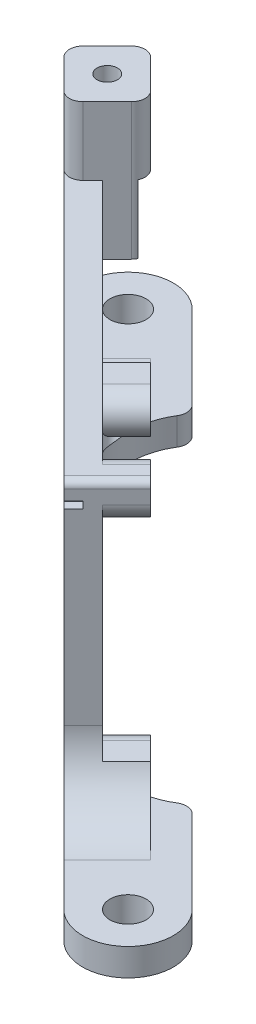
from build123d import *

# Parameters (mm, degrees)
SKETCH_1_R               = 2.65
EXTRUDE_1_DEPTH          = 4
SKETCH_2_W               = 70
SKETCH_2_H               = 41
EXTRUDE_2_DEPTH          = 4
CUT_EXTRUDE_1_DEPTH      = 76.406398933
CUT_EXTRUDE_1_DEPTH_BACK = 4
FILLET_1_R               = 10
FILLET_2_R               = 10
FILLET_3_R               = 2
FILLET_4_R               = 1
CUT_EXTRUDE_2_DEPTH      = 7
EXTRUDE_START            = 5
EXTRUDE_3_DEPTH          = 5
CUT_EXTRUDE_3_DEPTH      = 2
FILLET_5_R               = 2
SKETCH_8_R               = 5
CUT_EXTRUDE_5_DEPTH      = 5
EXTRUDE_4_DEPTH          = 10
EXTRUDE_START_2          = 10
EXTRUDE_5_DEPTH          = 10
FILLET_6_R               = 2
SKETCH_11_R              = 1.65
CUT_EXTRUDE_6_DEPTH      = 10
SKETCH_12_R              = 1.5
CUT_EXTRUDE_7_DEPTH      = 17
EXTRUDE_START_3          = -3
SKETCH_13_R              = 1.5
EXTRUDE_6_DEPTH          = 3
SKETCH_14_W              = 2
SKETCH_14_H              = 10
CUT_EXTRUDE_8_DEPTH      = 1.3


with BuildPart() as part:
    # 草图1 → 凸台-拉伸1 (new body)
    with BuildSketch(Plane(origin=(0, 0, 0), x_dir=(1, 0, 0), z_dir=(0, 1, 0))):
        with BuildLine():
            Line((33.397739905, -42.802260095), (-42.802260095, 33.397739905))
            ThreePointArc((-42.802260095, 33.397739905), (-42.802260095, 42.802260095), (-33.397739905, 42.802260095))
            Line((-33.397739905, 42.802260095), (42.802260095, -33.397739905))
            ThreePointArc((42.802260095, -33.397739905), (42.802260095, -42.802260095), (33.397739905, -42.802260095))
        make_face()
        with Locations(Location((38.1, -38.1, 0), (0, 0, 270))):
            Circle(SKETCH_1_R, mode=Mode.SUBTRACT)
        with Locations(Location((-38.1, 38.1, 0), (0, 0, 270))):
            Circle(SKETCH_1_R, mode=Mode.SUBTRACT)
    extrude(amount=EXTRUDE_1_DEPTH)

    # 草图2 → 凸台-拉伸2 (add)
    with BuildSketch(Plane(origin=(-4.702260095, 0, 4.702260095), x_dir=(0.7071067811865476, 0, 0.7071067811865476), z_dir=(-0.7071067811865476, 0, 0.7071067811865476))):
        with Locations((0, 24.5)):
            Rectangle(SKETCH_2_W, SKETCH_2_H)
    extrude(amount=-EXTRUDE_2_DEPTH)

    # 草图3 → 切除-拉伸1 (cut, two sides: drawn at the far end of the back side and taken through both)
    with BuildSketch(Plane(origin=(0, 4, 0), x_dir=(1, 0, 0), z_dir=(0, 1, 0)).offset(-CUT_EXTRUDE_1_DEPTH_BACK)):
        Polygon((-20.046477247, 29.450997436), (-26.622570312, 22.874904371), (22.874904371, -26.622570312), (29.450997436, -20.046477247), align=None)
    extrude(amount=CUT_EXTRUDE_1_DEPTH + CUT_EXTRUDE_1_DEPTH_BACK, mode=Mode.SUBTRACT)

    # 圆角1
    # the kernel refuses this fillet: 10 mm, written as the material it adds along each edge
    with BuildSketch(Plane(origin=(22.874904371, 0, 26.622570312), x_dir=(0.7071067811865445, 0, -0.7071067811865506), z_dir=(0, 1, 0))) as fillet_1_piece_1:
        with BuildLine():
            CenterArc((10, 9.975469914), FILLET_1_R, 180, 85.986012782)
            Line((0, 9.975469914), (0, 0))
            Line((0, 0), (9.3, 0))
        make_face()
    extrude(amount=4)
    with BuildSketch(Plane(origin=(-26.622570312, 0, -22.874904371), x_dir=(0.7071067811865478, 0, 0.7071067811865474), z_dir=(0, 1, 0))) as fillet_1_piece_2:
        with BuildLine():
            CenterArc((9.975469914, 10), FILLET_1_R, 184.013987218, 85.986012782)
            Line((0, 9.3), (0, 0))
            Line((0, 0), (9.975469914, 0))
        make_face()
    extrude(amount=4)

    # 圆角2
    fillet_2_edges = [part.edges().sort_by_distance(p)[0] for p in [
        (-28.036783874, 4, -21.460690809),
        (21.460690809, 4, 28.036783874),
    ]]
    fillet(fillet_2_edges, radius=FILLET_2_R)

    # 圆角3
    fillet_3_edges = [part.edges().sort_by_distance(p)[0] for p in [
        (-26.631243007, 4, -22.883577067),
        (22.883577067, 4, 26.631243007),
    ]]
    fillet(fillet_3_edges, radius=FILLET_3_R)

    # 圆角4
    fillet_4_edges = [part.edges().sort_by_distance(p)[0] for p in [
        (-28.036783874, 45, -21.460690809),
        (21.460690809, 45, 28.036783874),
    ]]
    fillet(fillet_4_edges, radius=FILLET_4_R)

    # 草图4 → 切除-拉伸2 (cut, symmetric)
    with BuildSketch(Plane(origin=(-1.87383297, 0, 1.87383297), x_dir=(-0.7071067811865475, 0, -0.7071067811865477), z_dir=(0.7071067811865477, 0, -0.7071067811865475))):
        with BuildLine():
            ThreePointArc((-32, 40.35), (-30.833273811, 40.833273811), (-30.35, 42))
            Line((-30.35, 42), (-32, 42))
            Line((-32, 42), (-32, 40.35))
        make_face()
        with BuildLine():
            Line((-32, 42), (-30.35, 42))
            ThreePointArc((-30.35, 42), (-33.166726189, 43.166726189), (-32, 40.35))
            Line((-32, 40.35), (-32, 42))
        make_face()
        with BuildLine():
            ThreePointArc((33.65, 42), (32, 43.65), (30.35, 42))
            Line((30.35, 42), (32, 42))
            Line((32, 42), (32, 40.35))
            ThreePointArc((32, 40.35), (33.166726189, 40.833273811), (33.65, 42))
        make_face()
        with BuildLine():
            Line((32, 42), (30.35, 42))
            ThreePointArc((30.35, 42), (30.833273811, 40.833273811), (32, 40.35))
            Line((32, 40.35), (32, 42))
        make_face()
        with BuildLine():
            Line((32, 7), (30.35, 7))
            ThreePointArc((30.35, 7), (30.436665937, 6.472281696), (30.687559525, 6))
            Line((30.687559525, 6), (33.312440475, 6))
            ThreePointArc((33.312440475, 6), (33.563334063, 6.472281696), (33.65, 7))
            ThreePointArc((33.65, 7), (33.166726189, 8.166726189), (32, 8.65))
            Line((32, 8.65), (32, 7))
        make_face()
        with BuildLine():
            ThreePointArc((32, 8.65), (30.833273811, 8.166726189), (30.35, 7))
            Line((30.35, 7), (32, 7))
            Line((32, 7), (32, 8.65))
        make_face()
        with BuildLine():
            ThreePointArc((-30.687559525, 6), (-30.436665937, 6.472281696), (-30.35, 7))
            Line((-30.35, 7), (-32, 7))
            Line((-32, 7), (-32, 8.65))
            ThreePointArc((-32, 8.65), (-33.478597308, 7.732290926), (-33.312440475, 6))
            Line((-33.312440475, 6), (-30.687559525, 6))
        make_face()
        with BuildLine():
            Line((-32, 7), (-30.35, 7))
            ThreePointArc((-30.35, 7), (-30.833273811, 8.166726189), (-32, 8.65))
            Line((-32, 8.65), (-32, 7))
        make_face()
        with BuildLine():
            Line((33.312440475, 6), (30.687559525, 6))
            ThreePointArc((30.687559525, 6), (32, 5.35), (33.312440475, 6))
        make_face()
        with BuildLine():
            ThreePointArc((-33.312440475, 6), (-32, 5.35), (-30.687559525, 6))
            Line((-30.687559525, 6), (-33.312440475, 6))
        make_face()
    extrude(amount=CUT_EXTRUDE_2_DEPTH, both=True, mode=Mode.SUBTRACT)

    # 草图5 → 凸台-拉伸3 (add)
    with BuildSketch(Plane(origin=(-1.87383297, 0, 1.87383297), x_dir=(-0.7071067811865475, 0, -0.7071067811865477), z_dir=(0.7071067811865477, 0, -0.7071067811865475)).offset(EXTRUDE_START)):
        with BuildLine():
            ThreePointArc((32, 10), (29.550510257, 8.732050808), (29.171572875, 6))
            Line((29.171572875, 6), (30.687559525, 6))
            ThreePointArc((30.687559525, 6), (30.521402692, 7.732290926), (32, 8.65))
            Line((32, 8.65), (32, 10))
        make_face()
        with BuildLine():
            ThreePointArc((35, 7), (34.121320344, 9.121320344), (32, 10))
            Line((32, 10), (32, 8.65))
            ThreePointArc((32, 8.65), (33.166726189, 8.166726189), (33.65, 7))
            Line((33.65, 7), (35, 7))
        make_face()
        with BuildLine():
            Line((35.83484861, 10), (32, 10))
            ThreePointArc((32, 10), (34.121320344, 9.121320344), (35, 7))
            Line((35, 7), (37.858571571, 7))
            ThreePointArc((37.858571571, 7), (36.709877182, 8.407696033), (35.83484861, 10))
        make_face()
        with BuildLine():
            ThreePointArc((35, 7), (34.956795679, 6.492694064), (34.828427125, 6))
            Line((34.828427125, 6), (39, 6))
            ThreePointArc((39, 6), (38.410289438, 6.478317029), (37.858571571, 7))
            Line((37.858571571, 7), (35, 7))
        make_face()
        with BuildLine():
            ThreePointArc((34.828427125, 6), (33.732050808, 4.550510257), (32, 4))
            Line((32, 4), (45, 4))
            ThreePointArc((45, 4), (41.83772234, 4.513167019), (39, 6))
            Line((39, 6), (34.828427125, 6))
        make_face()
        with BuildLine():
            ThreePointArc((29.171572875, 6), (30.267949192, 4.550510257), (32, 4))
            ThreePointArc((32, 4), (33.732050808, 4.550510257), (34.828427125, 6))
            Line((34.828427125, 6), (33.312440475, 6))
            ThreePointArc((33.312440475, 6), (32, 5.35), (30.687559525, 6))
            Line((30.687559525, 6), (29.171572875, 6))
        make_face()
        with BuildLine():
            Line((33.312440475, 6), (34.828427125, 6))
            ThreePointArc((34.828427125, 6), (34.956795679, 6.492694064), (35, 7))
            Line((35, 7), (33.65, 7))
            ThreePointArc((33.65, 7), (33.563334063, 6.472281696), (33.312440475, 6))
        make_face()
        with BuildLine():
            Line((-39, 6), (-34.828427125, 6))
            ThreePointArc((-34.828427125, 6), (-34.956795679, 6.492694064), (-35, 7))
            Line((-35, 7), (-37.858571571, 7))
            ThreePointArc((-37.858571571, 7), (-38.410289438, 6.478317029), (-39, 6))
        make_face()
        with BuildLine():
            Line((-45, 4), (-32, 4))
            ThreePointArc((-32, 4), (-33.732050808, 4.550510257), (-34.828427125, 6))
            Line((-34.828427125, 6), (-39, 6))
            ThreePointArc((-39, 6), (-41.83772234, 4.513167019), (-45, 4))
        make_face()
        with BuildLine():
            ThreePointArc((-32, 4), (-30.267949192, 4.550510257), (-29.171572875, 6))
            Line((-29.171572875, 6), (-30.687559525, 6))
            ThreePointArc((-30.687559525, 6), (-32, 5.35), (-33.312440475, 6))
            Line((-33.312440475, 6), (-34.828427125, 6))
            ThreePointArc((-34.828427125, 6), (-33.732050808, 4.550510257), (-32, 4))
        make_face()
        with BuildLine():
            Line((-30.687559525, 6), (-29.171572875, 6))
            ThreePointArc((-29.171572875, 6), (-29.043204321, 6.492694064), (-29, 7))
            ThreePointArc((-29, 7), (-29.878679656, 9.121320344), (-32, 10))
            Line((-32, 10), (-32, 8.65))
            ThreePointArc((-32, 8.65), (-30.833273811, 8.166726189), (-30.35, 7))
            ThreePointArc((-30.35, 7), (-30.436665937, 6.472281696), (-30.687559525, 6))
        make_face()
        with BuildLine():
            Line((-32, 8.65), (-32, 10))
            ThreePointArc((-32, 10), (-34.121320344, 9.121320344), (-35, 7))
            Line((-35, 7), (-33.65, 7))
            ThreePointArc((-33.65, 7), (-33.166726189, 8.166726189), (-32, 8.65))
        make_face()
        with BuildLine():
            ThreePointArc((-35, 7), (-34.121320344, 9.121320344), (-32, 10))
            Line((-32, 10), (-35.83484861, 10))
            ThreePointArc((-35.83484861, 10), (-36.709877182, 8.407696033), (-37.858571571, 7))
            Line((-37.858571571, 7), (-35, 7))
        make_face()
        with BuildLine():
            Line((-34.828427125, 6), (-33.312440475, 6))
            ThreePointArc((-33.312440475, 6), (-33.563334063, 6.472281696), (-33.65, 7))
            Line((-33.65, 7), (-35, 7))
            ThreePointArc((-35, 7), (-34.956795679, 6.492694064), (-34.828427125, 6))
        make_face()
        with BuildLine():
            ThreePointArc((-29, 42), (-29.878679656, 44.121320344), (-32, 45))
            Line((-32, 45), (-32, 43.65))
            ThreePointArc((-32, 43.65), (-30.833273811, 43.166726189), (-30.35, 42))
            ThreePointArc((-30.35, 42), (-32, 40.35), (-33.65, 42))
            Line((-33.65, 42), (-35, 42))
            ThreePointArc((-35, 42), (-32, 39), (-29, 42))
        make_face()
        with BuildLine():
            Line((-32, 43.65), (-32, 45))
            ThreePointArc((-32, 45), (-34.121320344, 44.121320344), (-35, 42))
            Line((-35, 42), (-33.65, 42))
            ThreePointArc((-33.65, 42), (-33.166726189, 43.166726189), (-32, 43.65))
        make_face()
        with BuildLine():
            ThreePointArc((-35, 42), (-34.121320344, 44.121320344), (-32, 45))
            Line((-32, 45), (-34, 45))
            ThreePointArc((-34, 45), (-34.707106781, 44.707106781), (-35, 44))
            Line((-35, 44), (-35, 42))
        make_face()
        with BuildLine():
            ThreePointArc((32, 45), (29.878679656, 39.878679656), (35, 42))
            Line((35, 42), (33.65, 42))
            ThreePointArc((33.65, 42), (30.833273811, 40.833273811), (32, 43.65))
            Line((32, 43.65), (32, 45))
        make_face()
        with BuildLine():
            Line((33.65, 42), (35, 42))
            ThreePointArc((35, 42), (34.121320344, 44.121320344), (32, 45))
            Line((32, 45), (32, 43.65))
            ThreePointArc((32, 43.65), (33.166726189, 43.166726189), (33.65, 42))
        make_face()
        with BuildLine():
            ThreePointArc((32, 45), (34.121320344, 44.121320344), (35, 42))
            Line((35, 42), (35, 44))
            ThreePointArc((35, 44), (34.707106781, 44.707106781), (34, 45))
            Line((34, 45), (32, 45))
        make_face()
    extrude(amount=-EXTRUDE_3_DEPTH)

    # 草图6 → 切除-拉伸3 (cut)
    with BuildSketch(Plane(origin=(-4.702260095, 0, 4.702260095), x_dir=(0.7071067811865476, 0, 0.7071067811865476), z_dir=(-0.7071067811865476, 0, 0.7071067811865476))):
        Polygon((-28.709103466, 42), (-30.354551733, 44.85), (-33.645448267, 44.85), (-35.290896534, 42), (-33.645448267, 39.15), (-30.354551733, 39.15), align=None)
        Polygon((35.290896534, 42), (33.645448267, 44.85), (30.354551733, 44.85), (28.709103466, 42), (30.354551733, 39.15), (33.645448267, 39.15), align=None)
        Polygon((35.290896534, 7), (33.645448267, 9.85), (30.354551733, 9.85), (28.709103466, 7), (30.354551733, 4.15), (33.645448267, 4.15), align=None)
        Polygon((-28.709103466, 7), (-30.354551733, 9.85), (-33.645448267, 9.85), (-35.290896534, 7), (-33.645448267, 4.15), (-30.354551733, 4.15), align=None)
    extrude(amount=-CUT_EXTRUDE_3_DEPTH, mode=Mode.SUBTRACT)

    # 圆角5
    fillet_5_edges = [part.edges().sort_by_distance(p)[0] for p in [
        (29.450997436, 2, 20.046477247),
        (-20.046477247, 2, -29.450997436),
    ]]
    fillet(fillet_5_edges, radius=FILLET_5_R)

    # 草图8 → 切除-拉伸5 (cut)
    with BuildSketch(Plane(origin=(0, 0, 0), x_dir=(1, 0, 0), z_dir=(0, 1, 0))):
        with Locations((14.468399934, -23.728285636)):
            Circle(SKETCH_8_R)
        with Locations((-14.765754799, 9.901762381)):
            Circle(SKETCH_8_R)
    extrude(amount=CUT_EXTRUDE_5_DEPTH, mode=Mode.SUBTRACT)

    # 草图9 → 凸台-拉伸4 (add)
    with BuildSketch(Plane(origin=(0, 45, 0), x_dir=(1, 0, 0), z_dir=(0, 1, 0))):
        with BuildLine():
            Line((-15.308861813, 18.632263684), (-17.430182156, 16.510943341))
            ThreePointArc((-17.430182156, 16.510943341), (-17.105023029, 16.024308317), (-16.990842328, 15.450283169))
            ThreePointArc((-16.990842328, 15.450283169), (-17.222049612, 14.650180024), (-17.844395719, 14.096729778))
            Line((-17.844395719, 14.096729778), (-15.308861813, 11.561195872))
            Line((-15.308861813, 11.561195872), (-11.773327907, 15.096729778))
            Line((-11.773327907, 15.096729778), (-15.308861813, 18.632263684))
        make_face()
        with BuildLine():
            ThreePointArc((-19.844395719, 16.096729778), (-18.744495296, 16.928681008), (-17.430182156, 16.510943341))
            Line((-17.430182156, 16.510943341), (-15.308861813, 18.632263684))
            Line((-15.308861813, 18.632263684), (-18.844395719, 22.16779759))
            Line((-18.844395719, 22.16779759), (-22.379929625, 18.632263684))
            Line((-22.379929625, 18.632263684), (-19.844395719, 16.096729778))
        make_face()
        Polygon((-24.501249968, 20.753584028), (-22.379929625, 18.632263684), (-18.844395719, 22.16779759), (-20.965716062, 24.289117934), align=None)
    extrude(amount=-EXTRUDE_4_DEPTH)

    # 草图10 → 凸台-拉伸5 (add)
    with BuildSketch(Plane(origin=(0, 45, 0), x_dir=(1, 0, 0), z_dir=(0, 1, 0)).offset(EXTRUDE_START_2)):
        Polygon((-11.773327907, 15.096729778), (-18.137288937, 8.732768748), (-25.208356749, 15.80383656), (-18.844395719, 22.16779759), align=None)
        with BuildLine():
            Line((-17.844395719, 14.096729778), (-19.844395719, 16.096729778))
            ThreePointArc((-19.844395719, 16.096729778), (-17.430182156, 16.510943341), (-17.844395719, 14.096729778))
        make_face(mode=Mode.SUBTRACT)
    extrude(amount=-EXTRUDE_5_DEPTH)

    # 圆角6
    # the kernel refuses this fillet: 2 mm, written as the material it takes off along each edge
    with BuildSketch(Plane(origin=(-11.773327907, 45, -15.096729778), x_dir=(-0.7071067811865476, 0, 0.7071067811865476), z_dir=(0, -1, 0)), Plane(origin=(-18.137288937, 60, -8.732768748), x_dir=(-0.7071067811865493, 0, -0.7071067811865458), z_dir=(0, -1, 0)), Plane(origin=(-11.773327907, 60, -15.096729778), x_dir=(-0.707106781186548, 0, 0.7071067811865471), z_dir=(0, -1, 0))) as fillet_6_piece_1:
        with BuildLine():
            CenterArc((FILLET_6_R, FILLET_6_R), FILLET_6_R, 180, 90)
            Line((0, FILLET_6_R), (0, 0))
            Line((0, 0), (FILLET_6_R, 0))
        make_face()
    extrude(amount=15, mode=Mode.SUBTRACT)
    with BuildSketch(Plane(origin=(-18.844395719, 60, -22.16779759), x_dir=(-0.7071067811865476, 0, 0.7071067811865476), z_dir=(0, -1, 0)), Plane(origin=(-25.208356749, 60, -15.80383656), x_dir=(0.7071067811865477, 0, 0.7071067811865477), z_dir=(0, -1, 0))) as fillet_6_piece_2:
        with BuildLine():
            CenterArc((FILLET_6_R, -FILLET_6_R), FILLET_6_R, 90, 90)
            Line((0, -FILLET_6_R), (0, 0))
            Line((0, 0), (FILLET_6_R, 0))
        make_face()
    extrude(amount=15, mode=Mode.SUBTRACT)

    # 草图11 → 切除-拉伸6 (cut)
    with BuildSketch(Plane(origin=(1.661700936, 0, -1.661700936), x_dir=(-0.7071067811865476, 0, -0.7071067811865476), z_dir=(0.7071067811865476, 0, -0.7071067811865476))):
        with Locations((32, 42)):
            Circle(SKETCH_11_R)
    extrude(amount=-CUT_EXTRUDE_6_DEPTH, mode=Mode.SUBTRACT)

    # 草图12 → 切除-拉伸7 (cut)
    with BuildSketch(Plane(origin=(0, 55, 0), x_dir=(1, 0, 0), z_dir=(0, 1, 0))):
        with Locations(Location((-18.490842328, 15.450283169, 0), (0, 0, 270))):
            Circle(SKETCH_12_R)
    extrude(amount=-CUT_EXTRUDE_7_DEPTH, mode=Mode.SUBTRACT)

    # 草图13 → 凸台-拉伸6 (add)
    with BuildSketch(Plane.XZ.offset(-35).offset(EXTRUDE_START_3)):
        with Locations(Location((-18.490842328, -15.450283169, 0), (0, 0, 90))):
            Circle(SKETCH_13_R)
    extrude(amount=EXTRUDE_6_DEPTH)

    # 草图14 → 切除-拉伸8 (cut)
    with BuildSketch(Plane(origin=(1.661700936, 0, -1.661700936), x_dir=(-0.7071067811865476, 0, -0.7071067811865476), z_dir=(0.7071067811865476, 0, -0.7071067811865476))):
        with BuildLine():
            ThreePointArc((32, 39), (29.878679656, 39.878679656), (29, 42))
            Line((29, 42), (29, 45))
            Line((29, 45), (27, 45))
            Line((27, 45), (21, 45))
            Line((21, 45), (21, 35))
            Line((21, 35), (32, 35))
            Line((32, 35), (32, 39))
        make_face()
        with Locations((20, 40)):
            Rectangle(SKETCH_14_W, SKETCH_14_H)
    extrude(amount=-CUT_EXTRUDE_8_DEPTH, mode=Mode.SUBTRACT)


solid = part.part
